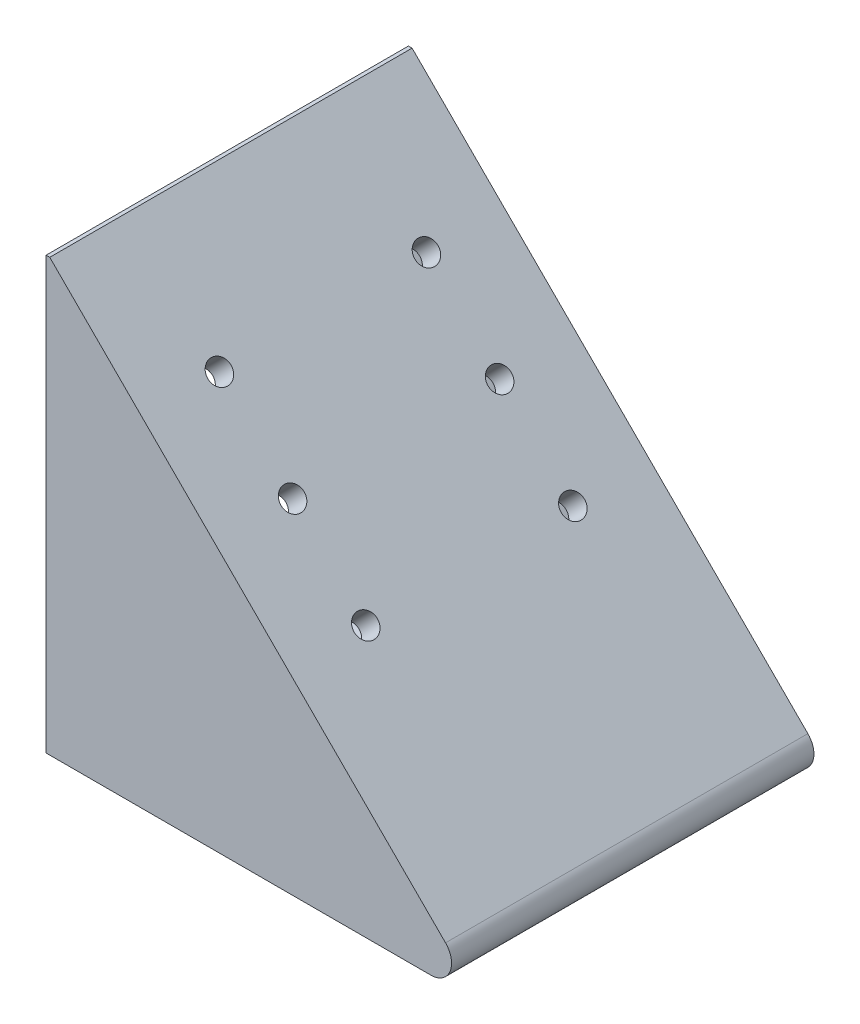
from build123d import *

# Parameters (mm, degrees)
EXTRUDE_1_DEPTH             = 70
FILLET_1_R                  = 4
CHAMFER_1_SIZE              = 1
CHAMFER_1_SIZE2             = 0.707106781
SHELL_START                 = 5
SHELL_1_DEPTH               = 60
HOLE_WIZARD_4_5_4_5_1_D     = 4.5
HOLE_WIZARD_4_5_4_5_1_DEPTH = 10
HOLE_WIZARD_4_5_4_5_1_TIP   = 1.351936393


# Read off the part's stored shape, not the designer's step: 抽壳1
with BuildPart() as part:
    # 草图1 → 凸台-拉伸1 (new body)
    with BuildSketch(Plane.XY):
        Polygon((0, 0), (84, 0), (0, 84), align=None)
    extrude(amount=EXTRUDE_1_DEPTH)

    # 圆角1
    fillet_1_edges = [part.edges().sort_by_distance(p)[0] for p in [
        (84, 0, 35),
    ]]
    fillet(fillet_1_edges, radius=FILLET_1_R)

    # 倒角1
    chamfer_1_edges = [part.edges().sort_by_distance(p)[0] for p in [
        (0, 84, 35),
    ]]
    chamfer_1_side = [part.faces().sort_by_distance(p)[0] for p in [
        (38.585786438, 45.414213562, 35),
    ]]
    chamfer(chamfer_1_edges, length=CHAMFER_1_SIZE, length2=CHAMFER_1_SIZE2, reference=chamfer_1_side[0])

    # 抽壳1 outline → 抽壳1 (cut)
    with BuildSketch(Plane.XY.offset(SHELL_START)):
        Polygon((0, 5), (71.928932188, 5), (0, 76.928932188), align=None)
    extrude(amount=SHELL_1_DEPTH, mode=Mode.SUBTRACT)

    # Ø4.5 (4.5) 直径孔1
    with Locations(Plane(origin=(42, 42, 0), x_dir=(0.7071067811865475, -0.7071067811865477, 0), z_dir=(0.7071067811865477, 0.7071067811865475, 0))):
        with Locations((-33.25988463, -55), (-13.25988463, -55), (6.74011537, -55), (6.74011537, -15), (-13.25988463, -15), (-33.25988463, -15)):
            Hole(HOLE_WIZARD_4_5_4_5_1_D / 2, depth=HOLE_WIZARD_4_5_4_5_1_DEPTH)
            with Locations((0, 0, -(HOLE_WIZARD_4_5_4_5_1_DEPTH + HOLE_WIZARD_4_5_4_5_1_TIP / 2))):  # 118° drill point
                Cone(0, HOLE_WIZARD_4_5_4_5_1_D / 2, HOLE_WIZARD_4_5_4_5_1_TIP, mode=Mode.SUBTRACT)


solid = part.part
